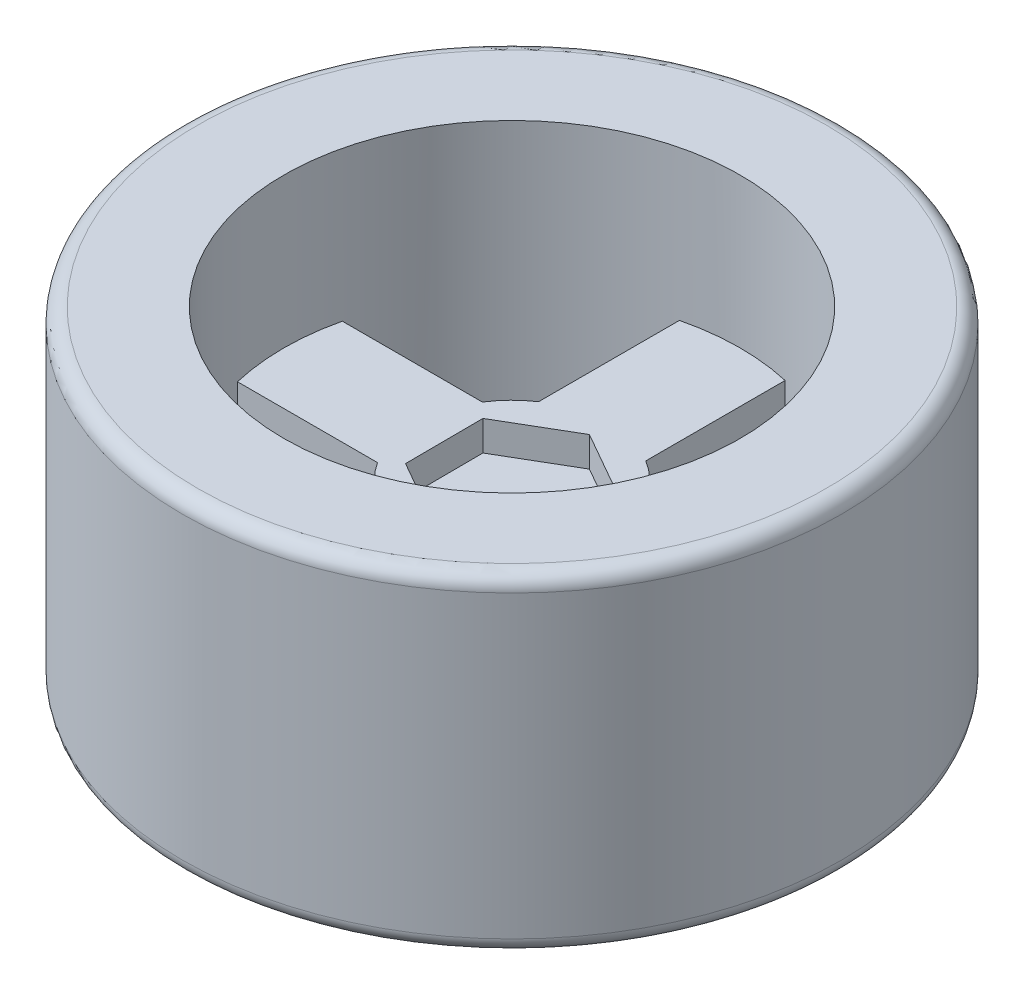
from build123d import *

# Parameters (mm, degrees)
SKETCH1_R           = 22
BOSS_EXTRUDE2_DEPTH = 22
SKETCH3_R           = 1.5
BOSS_EXTRUDE3_DEPTH = 12
SKETCH4_R           = 4.990818698
CUT_EXTRUDE1_DEPTH  = 6
CUT_EXTRUDE2_DEPTH  = 2
FILLET1_R           = 1
FILLET2_R           = 1


with BuildPart() as part:
    # Sketch1 → Boss-Extrude2 (new body)
    with BuildSketch(Plane(origin=(0, 0, 0), x_dir=(1, 0, 0), z_dir=(0, 1, 0))):
        with Locations((-0.049514064, 2.832612422)):
            Circle(SKETCH1_R)
        with BuildLine():
            ThreePointArc((-14.878078006, 6.332612422), (-10.77871042, 13.650220944), (-3.427707319, 17.689399387))
            ThreePointArc((-3.427707319, 17.689399387), (0.075639897, 18.068118487), (3.572292681, 17.631897015))
            ThreePointArc((3.572292681, 17.631897015), (10.7681799, 13.56172263), (14.779049878, 6.332612422))
            ThreePointArc((14.779049878, 6.332612422), (15.084299184, 4.594431121), (15.186506039, 2.832612422))
            ThreePointArc((15.186506039, 2.832612422), (15.084299184, 1.070793722), (14.779049878, -0.667387578))
            ThreePointArc((14.779049878, -0.667387578), (10.7681799, -7.896497787), (3.572292681, -11.966672172))
            ThreePointArc((3.572292681, -11.966672172), (0.075639897, -12.402893644), (-3.427707319, -12.024174543))
            ThreePointArc((-3.427707319, -12.024174543), (-10.77871042, -7.984996101), (-14.878078006, -0.667387578))
            ThreePointArc((-14.878078006, -0.667387578), (-15.285534168, 2.832612422), (-14.878078006, 6.332612422))
        make_face(mode=Mode.SUBTRACT)
    extrude(amount=BOSS_EXTRUDE2_DEPTH)


with BuildPart() as boss_extrude3_tool:
    # Sketch3 → Boss-Extrude3 (new body)
    with BuildSketch(Plane(origin=(0, 0, 0), x_dir=(-1, 0, 0), z_dir=(0, -1, 0))):
        with BuildLine():
            Line((-3.328678892, 17.689399127), (-3.328678892, 8.385792362))
            ThreePointArc((-3.328678892, 8.385792362), (-4.495647669, 7.479277859), (-5.427711213, 6.332612162))
            Line((-5.427711213, 6.332612162), (-14.77904958, 6.332612162))
            ThreePointArc((-14.77904958, 6.332612162), (-15.186505741, 2.832612162), (-14.77904958, -0.667387838))
            Line((-14.77904958, -0.667387838), (-5.427711213, -0.667387838))
            ThreePointArc((-5.427711213, -0.667387838), (-4.495647669, -1.814053536), (-3.328678892, -2.720568038))
            Line((-3.328678892, -2.720568038), (-3.328678892, -12.024174803))
            ThreePointArc((-3.328678892, -12.024174803), (0.174668323, -12.402893904), (3.671321108, -11.966672432))
            Line((3.671321108, -11.966672432), (3.671321108, -2.564842414))
            ThreePointArc((3.671321108, -2.564842414), (4.696898655, -1.711815111), (5.526739937, -0.667387838))
            Line((5.526739937, -0.667387838), (14.878078304, -0.667387838))
            ThreePointArc((14.878078304, -0.667387838), (15.183327611, 1.070793462), (15.285534465, 2.832612162))
            ThreePointArc((15.285534465, 2.832612162), (15.183327611, 4.594430862), (14.878078304, 6.332612162))
            Line((14.878078304, 6.332612162), (5.526739937, 6.332612162))
            ThreePointArc((5.526739937, 6.332612162), (4.696898655, 7.377039435), (3.671321108, 8.230066738))
            Line((3.671321108, 8.230066738), (3.671321108, 17.631896755))
            ThreePointArc((3.671321108, 17.631896755), (0.174668323, 18.068118227), (-3.328678892, 17.689399127))
        make_face()
        with Locations((0.049514362, 2.832612162)):
            Circle(SKETCH3_R, mode=Mode.SUBTRACT)
    extrude(amount=-BOSS_EXTRUDE3_DEPTH)


with BuildPart() as part_1:
    add(part.part)


with BuildPart() as part_2:
    # Boss-Extrude3: joined with boss_extrude3_tool
    add(part_1.part.fuse(boss_extrude3_tool.part, tol=0.00001))

    # Sketch4 → Cut-Extrude1 (cut)
    with BuildSketch(Plane(origin=(0, 0, 0), x_dir=(-1, 0, 0), z_dir=(0, -1, 0))):
        with Locations((0.049514362, 2.832612162)):
            Circle(SKETCH4_R)
    extrude(amount=-CUT_EXTRUDE1_DEPTH, mode=Mode.SUBTRACT)

    # Sketch5 → Cut-Extrude2 (cut)
    with BuildSketch(Plane(origin=(0, 12, 0), x_dir=(1, 0, 0), z_dir=(0, 1, 0))):
        Polygon((-4.56347244, 5.406360618), (-4.535424574, 0.210283895), (-0.021466198, -2.363464302), (4.464444311, 0.258864225), (4.436396445, 5.454940948), (-0.077561931, 8.028689145), align=None)
    extrude(amount=-CUT_EXTRUDE2_DEPTH, mode=Mode.SUBTRACT)

    # Fillet1
    fillet1_edges = [part_2.edges().sort_by_distance(p)[0] for p in [
        (-22.049514064, 22, -2.832612422),
    ]]
    fillet(fillet1_edges, radius=FILLET1_R)

    # Fillet2
    fillet2_edges = [part_2.edges().sort_by_distance(p)[0] for p in [
        (-22.049514064, 0, -2.832612422),
    ]]
    fillet(fillet2_edges, radius=FILLET2_R)


solid = part_2.part
